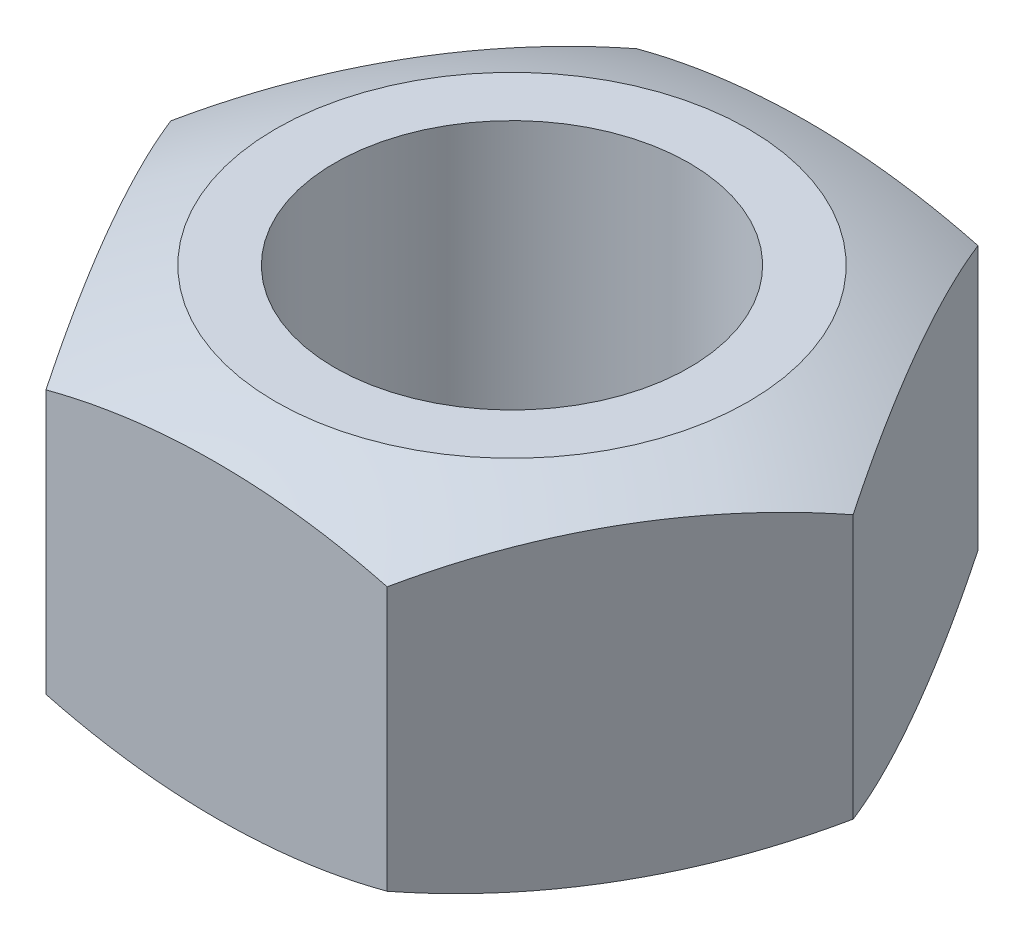
from build123d import *

# Parameters (mm, degrees)
BODY_DEPTH = 6
THREAD_R   = 3
HOLE_DEPTH = 10.712534856


with BuildPart() as part:
    # profile → body (new body)
    with BuildSketch(Plane(origin=(0, 0, 0), x_dir=(1, 0, 0), z_dir=(0, 1, 0))):
        Polygon((5.773502692, 0), (2.886751346, 5), (-2.886751346, 5), (-5.773502692, 0), (-2.886751346, -5), (2.886751346, -5), align=None)
    extrude(amount=BODY_DEPTH)

    # Sketch7 → fillet 2 (revolve, cut)
    with BuildSketch(Plane.XY):
        with BuildLine():
            Line((5.773502692, 5.23120945), (5.773502692, 0.76879055))
            ThreePointArc((5.773502692, 0.76879055), (2.974697147, -0.302787414), (0, -0.667161797))
            Line((0, -0.667161797), (0, -3.492163531))
            Line((0, -3.492163531), (6.272991846, -3.492163531))
            Line((6.272991846, -3.492163531), (6.272991846, 7.504587098))
            Line((6.272991846, 7.504587098), (0, 7.504587098))
            Line((0, 7.504587098), (0, 6.667161797))
            ThreePointArc((0, 6.667161797), (2.974697147, 6.302787414), (5.773502692, 5.23120945))
        make_face()
    revolve(axis=Axis((0, 0, 0), (0, 1, 0)), mode=Mode.SUBTRACT)

    # thread (on Top Plane) → hole (cut, through all)
    with BuildSketch(Plane(origin=(0, 0, 0), x_dir=(1, 0, 0), z_dir=(0, 1, 0))):
        with Locations(Location((0, 0, 0), (0, 0, 270))):
            Circle(THREAD_R)
    extrude(amount=HOLE_DEPTH, mode=Mode.SUBTRACT)


solid = part.part
